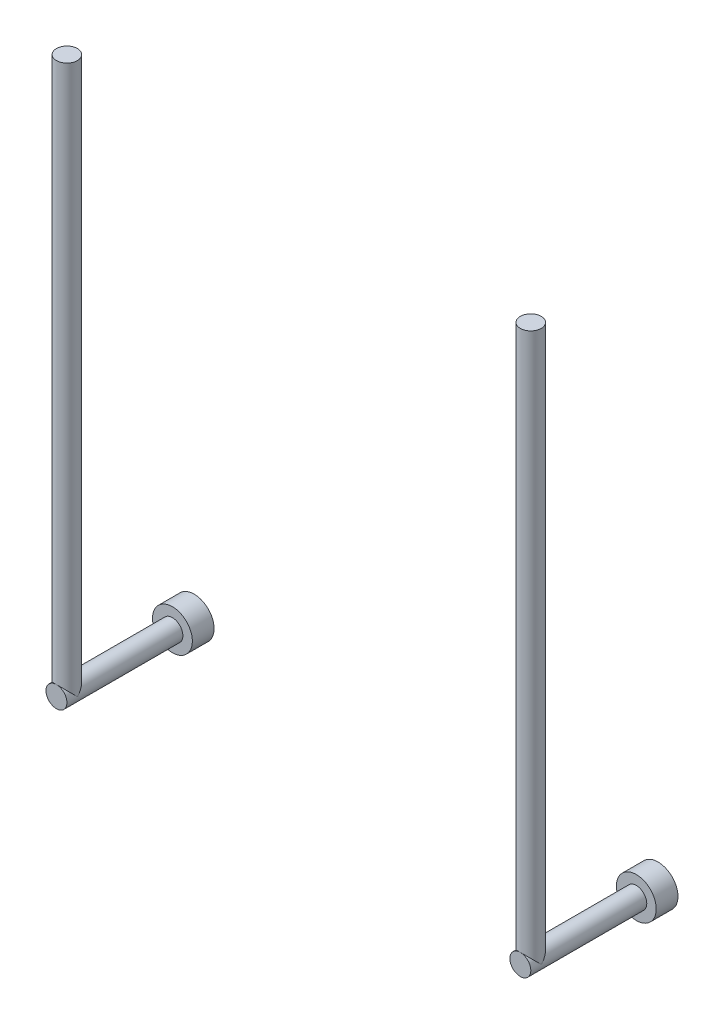
from build123d import *

# Parameters (mm, degrees)
SKETCH1_R                = 2.75
BOLT_HEAD_32_DEPTH       = 3
SKETCH2_R                = 1.44375
KEY_SHORT_ARM_32_DEPTH   = 17.99
SKETCH3_R                = 1.44375
KEY_LONG_ARM_32_DEPTH    = 76
SKETCH4_R                = 2.75
BOLT_HEAD_32_2_DEPTH     = 3
SKETCH5_R                = 1.44375
KEY_SHORT_ARM_32_2_DEPTH = 17.99
SKETCH6_R                = 1.44375
KEY_LONG_ARM_32_2_DEPTH  = 76


with BuildPart() as part:
    # Sketch1 → Bolt Head -32 (new body)
    with BuildSketch(Plane.XY.offset(14.3)):
        with Locations((-32, -20)):
            Circle(SKETCH1_R)
    extrude(amount=BOLT_HEAD_32_DEPTH)


with BuildPart() as body_2:
    # Sketch2 → Key Short Arm -32 (new body)
    with BuildSketch(Plane.XY.offset(15.31)):
        with Locations((-32, -20)):
            Circle(SKETCH2_R)
    extrude(amount=KEY_SHORT_ARM_32_DEPTH)


with BuildPart() as body_3:
    # Sketch3 → Key Long Arm -32 (new body)
    with BuildSketch(Plane(origin=(0, -20, 0), x_dir=(1, 0, 0), z_dir=(0, 1, 0))):
        with Locations((-32, -31.85625)):
            Circle(SKETCH3_R)
    extrude(amount=KEY_LONG_ARM_32_DEPTH)


with BuildPart() as body_4:
    # Sketch4 → Bolt Head _32 2 (new body)
    with BuildSketch(Plane.XY.offset(14.3)):
        with Locations((32, -20)):
            Circle(SKETCH4_R)
    extrude(amount=BOLT_HEAD_32_2_DEPTH)


with BuildPart() as body_5:
    # Sketch5 → Key Short Arm _32 2 (new body)
    with BuildSketch(Plane.XY.offset(15.31)):
        with Locations((32, -20)):
            Circle(SKETCH5_R)
    extrude(amount=KEY_SHORT_ARM_32_2_DEPTH)


with BuildPart() as body_6:
    # Sketch6 → Key Long Arm _32 2 (new body)
    with BuildSketch(Plane(origin=(0, -20, 0), x_dir=(1, 0, 0), z_dir=(0, 1, 0))):
        with Locations((32, -31.85625)):
            Circle(SKETCH6_R)
    extrude(amount=KEY_LONG_ARM_32_2_DEPTH)


solid = Compound([part.part, body_2.part, body_3.part, body_4.part, body_5.part, body_6.part])
